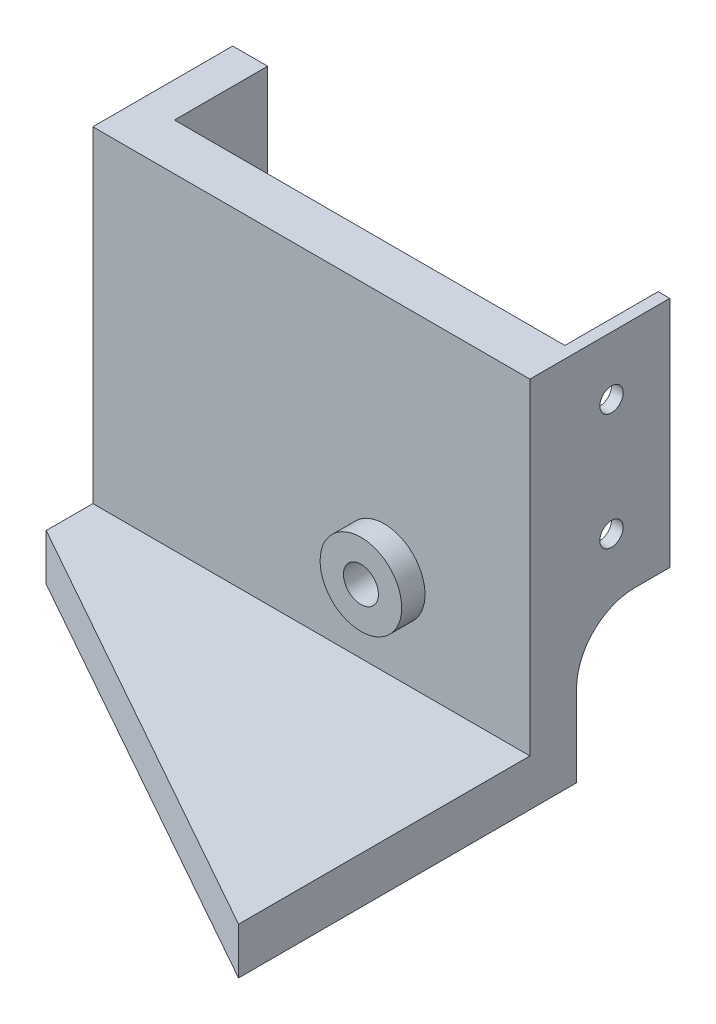
from build123d import *

# Parameters (mm, degrees)
BOSS_EXTRUDE1_DEPTH     = 20
SKETCH2_W               = 37.5
SKETCH2_H               = 4
BOSS_EXTRUDE2_DEPTH     = 12
FILLET1_R               = 5
SKETCH3_W               = 37.5
SKETCH3_H               = 4
BOSS_EXTRUDE3_DEPTH     = 25
SKETCH4_R               = 3.5
SKETCH4_R_2             = 1.5
BOSS_EXTRUDE4_DEPTH     = 2
SKETCH5_R               = 1.5
CUT_EXTRUDE1_DEPTH      = 49.324424466
CUT_EXTRUDE2_DEPTH      = 10
CUT_EXTRUDE3_DEPTH      = 50.307707308
CUT_EXTRUDE3_DEPTH_BACK = 50.307707308
SKETCH8_R               = 1


with BuildPart() as part:
    # Sketch1 → Boss-Extrude1 (new body)
    with BuildSketch(Plane(origin=(0, 0, 0), x_dir=(1, 0, 0), z_dir=(0, 1, 0))):
        Polygon((0, 12), (0, 0), (37.5, 0), (37.5, 12), (36.5, 12), (36.5, 4), (3, 4), (3, 12), align=None)
    extrude(amount=BOSS_EXTRUDE1_DEPTH)

    # Sketch2 → Boss-Extrude2 (add)
    with BuildSketch(Plane.XZ):
        with Locations((18.75, -2)):
            Rectangle(SKETCH2_W, SKETCH2_H)
    extrude(amount=BOSS_EXTRUDE2_DEPTH)

    # Fillet1
    fillet1_edges = [part.edges().sort_by_distance(p)[0] for p in [
        (1.5, 0, -4),
        (37, 0, -4),
    ]]
    fillet(fillet1_edges, radius=FILLET1_R)

    # Sketch3 → Boss-Extrude3 (add)
    with BuildSketch(Plane.XY):
        with Locations((18.75, -10)):
            Rectangle(SKETCH3_W, SKETCH3_H)
    extrude(amount=BOSS_EXTRUDE3_DEPTH)

    # Sketch4 → Boss-Extrude4 (add)
    with BuildSketch(Plane.XY):
        with Locations((25, -0.5)):
            Circle(SKETCH4_R)
        with Locations((25, -0.5)):
            Circle(SKETCH4_R_2, mode=Mode.SUBTRACT)
    extrude(amount=BOSS_EXTRUDE4_DEPTH)

    # Sketch5 → Cut-Extrude1 (cut, through all)
    with BuildSketch(Plane.XY.offset(2)):
        with Locations((25, -0.5)):
            Circle(SKETCH5_R)
    extrude(amount=-CUT_EXTRUDE1_DEPTH, mode=Mode.SUBTRACT)

    # Sketch6 → Cut-Extrude2 (cut)
    with BuildSketch(Plane(origin=(0, -8, 0), x_dir=(1, 0, 0), z_dir=(0, 1, 0))):
        Polygon((37.5, -25), (0, -4), (0, -25), align=None)
    extrude(amount=-CUT_EXTRUDE2_DEPTH, mode=Mode.SUBTRACT)

    # Sketch8 → Cut-Extrude3 (cut, two sides: drawn at the far end of the back side and taken through both)
    with BuildSketch(Plane(origin=(37.5, 0, 0), x_dir=(0, 0, -1), z_dir=(1, 0, 0)).offset(-CUT_EXTRUDE3_DEPTH_BACK)):
        with Locations((7, 15)):
            Circle(SKETCH8_R)
        with Locations((7, 5)):
            Circle(SKETCH8_R)
    extrude(amount=CUT_EXTRUDE3_DEPTH + CUT_EXTRUDE3_DEPTH_BACK, mode=Mode.SUBTRACT)


solid = part.part
